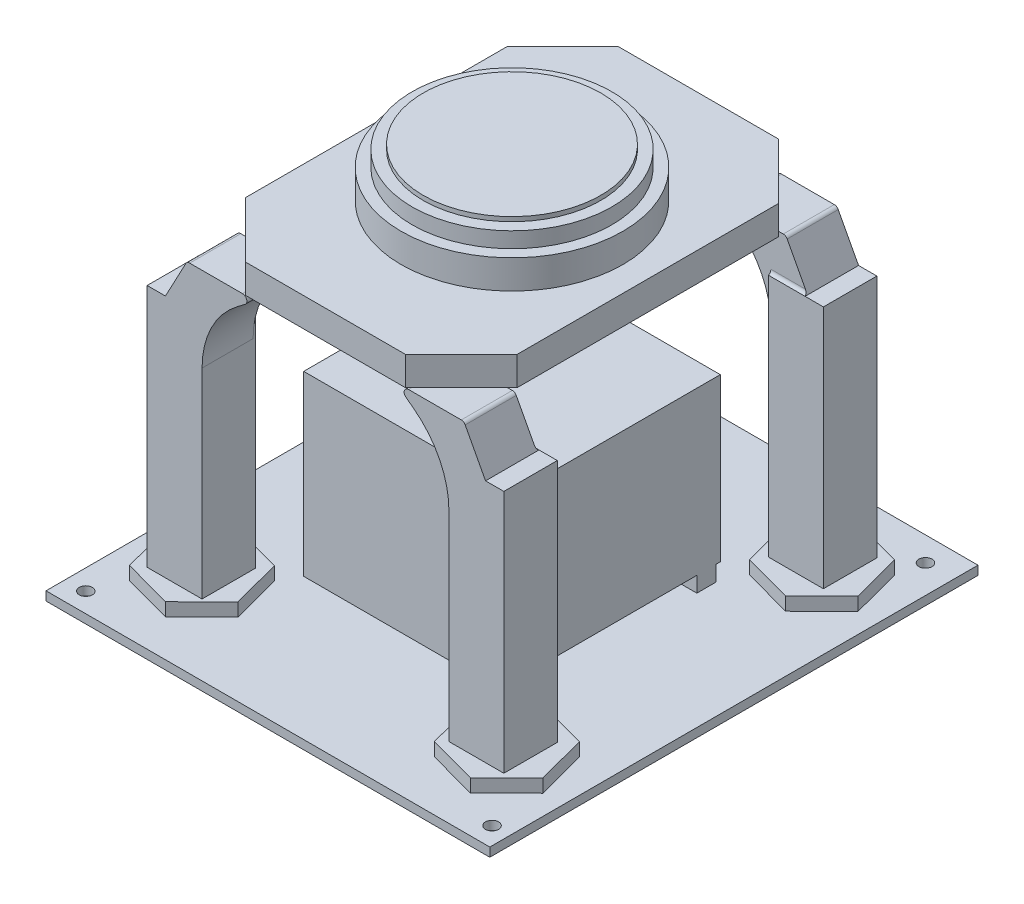
from build123d import *

# Parameters (mm, degrees)
SKETCH2_W            = 1000
SKETCH2_H            = 1100
BOSS_EXTRUDE1_DEPTH  = 20
BOSS_EXTRUDE2_DEPTH  = 30
SKETCH4_W            = 475.735232804
SKETCH4_H            = 462.959293972
BOSS_EXTRUDE3_DEPTH  = 400
SKETCH5_W            = 9.698613805
SKETCH5_H            = 34.812032077
CUT_EXTRUDE1_DEPTH   = 1012.606949035
SKETCH6_W            = 360.413866027
SKETCH6_H            = 34.812032077
CUT_EXTRUDE2_DEPTH   = 1012.606949035
SKETCH7_W            = 115
SKETCH7_H            = 115
BOSS_EXTRUDE4_DEPTH  = 550
BOSS_EXTRUDE6_DEPTH  = 115
FILLET3_R            = 200
FILLET5_R            = 10
FILLET6_R            = 10
FILLET3_OF_MIRROR2_R = 200
MIRROR3_START        = -420.238334409
MIRROR3_DEPTH        = 115
MIRROR3_START_2      = 299.761665591
MIRROR3_2_OUTLINE_W  = 123.720887542
MIRROR3_2_OUTLINE_H  = 550
MIRROR3_2_DEPTH      = 5.476668818
FILLET9_R            = 10
FILLET11_R           = 10
FILLET13_R           = 10
FILLET15_R           = 10
FILLET16_R           = 10
SKETCH9_W            = 611.925919606
SKETCH9_H            = 840.476668818
BOSS_EXTRUDE7_DEPTH  = 65
CUT_EXTRUDE3_DEPTH   = 65
SKETCH13_R           = 250
BOSS_EXTRUDE8_DEPTH  = 65
SKETCH14_R           = 225
BOSS_EXTRUDE9_DEPTH  = 35
SKETCH15_R           = 200
BOSS_EXTRUDE10_DEPTH = 10
SKETCH16_R           = 50
BOSS_EXTRUDE11_DEPTH = 5
SKETCH17_W           = 69.041025083
SKETCH17_H           = 59.313575352
BOSS_EXTRUDE12_DEPTH = 60
CUT_EXTRUDE4_DEPTH   = 90
SKETCH19_R           = 14.770979528
CUT_EXTRUDE5_DEPTH   = 90


# Read off the part's stored shape, not the designer's step: Mirror3
with BuildPart() as part:
    # Sketch2 → Boss-Extrude1 (new body)
    with BuildSketch(Plane(origin=(0, 0, 0), x_dir=(1, 0, 0), z_dir=(0, 1, 0))):
        Rectangle(SKETCH2_W, SKETCH2_H)
    extrude(amount=BOSS_EXTRUDE1_DEPTH)

    # Sketch3 → Boss-Extrude2 (add)
    with BuildSketch(Plane(origin=(0, 20, 0), x_dir=(1, 0, 0), z_dir=(0, 1, 0))):
        Polygon((-232.077673929, 324.898305528), (-261.747565619, 436.491454334), (-373.225013219, 466.593148806), (-455.032569128, 385.101694472), (-425.362677437, 273.508545666), (-313.885229838, 243.406851194), align=None)
        Polygon((-455.032569128, -324.898305528), (-425.362677437, -436.491454334), (-313.885229838, -466.593148806), (-232.077673929, -385.101694472), (-261.747565619, -273.508545666), (-373.225013219, -243.406851194), align=None)
        Polygon((261.747565619, -436.491454334), (373.225013219, -466.593148806), (455.032569128, -385.101694472), (425.362677437, -273.508545666), (313.885229838, -243.406851194), (232.077673929, -324.898305528), align=None)
        Polygon((261.747565619, 273.508545666), (373.225013219, 243.406851194), (455.032569128, 324.898305528), (425.362677437, 436.491454334), (313.885229838, 466.593148806), (232.077673929, 385.101694472), align=None)
    extrude(amount=BOSS_EXTRUDE2_DEPTH)

    # Sketch4 → Boss-Extrude3 (add)
    with BuildSketch(Plane(origin=(0, 20, 0), x_dir=(1, 0, 0), z_dir=(0, 1, 0))):
        Rectangle(SKETCH4_W, SKETCH4_H)
    extrude(amount=BOSS_EXTRUDE3_DEPTH)

    # Sketch5 → Cut-Extrude1 (cut, through all)
    with BuildSketch(Plane.ZY.offset(237.867616402)):
        with Locations((-226.630340084, 37.406016038)):
            Rectangle(SKETCH5_W, SKETCH5_H)
    extrude(amount=-CUT_EXTRUDE1_DEPTH, mode=Mode.SUBTRACT)

    # Sketch6 → Cut-Extrude2 (cut, through all)
    with BuildSketch(Plane.ZY.offset(237.867616402)):
        with Locations((1.590947851, 37.406016038)):
            Rectangle(SKETCH6_W, SKETCH6_H)
    extrude(amount=-CUT_EXTRUDE2_DEPTH, mode=Mode.SUBTRACT)

    # Sketch7 → Boss-Extrude4 (add)
    with BuildSketch(Plane(origin=(0, 50, 0), x_dir=(1, 0, 0), z_dir=(0, 1, 0))):
        with Locations((-335.639556229, 357.261665591)):
            Rectangle(SKETCH7_W, SKETCH7_H)
        with Locations((344.360443771, 357.261665591)):
            Rectangle(SKETCH7_W, SKETCH7_H)
        with Locations((-335.639556229, -362.738334409)):
            Rectangle(SKETCH7_W, SKETCH7_H)
        with Locations((344.360443771, -362.738334409)):
            Rectangle(SKETCH7_W, SKETCH7_H)
    boss_extrude4 = extrude(amount=BOSS_EXTRUDE4_DEPTH)

    # Sketch8 → Boss-Extrude6 (add)
    with BuildSketch(Plane.XY.offset(420.238334409)):
        Polygon((-311.971408496, 691.526051238), (-360.639390354, 600), (-278.139556229, 600), (-157.416765755, 691.526051238), align=None)
    boss_extrude6 = extrude(amount=-BOSS_EXTRUDE6_DEPTH)

    # Fillet3
    fillet3_edges = [part.edges().sort_by_distance(p)[0] for p in [
        (-278.139556229, 600, 362.738334409),
    ]]
    fillet(fillet3_edges, radius=FILLET3_R)

    # Fillet5
    fillet5_edges = [part.edges().sort_by_distance(p)[0] for p in [
        (-157.416765755, 691.526051238, 362.738334409),
    ]]
    fillet(fillet5_edges, radius=FILLET5_R)

    # Fillet6
    fillet6_edges = [part.edges().sort_by_distance(p)[0] for p in [
        (-311.971408496, 691.526051238, 362.738334409),
    ]]
    fillet(fillet6_edges, radius=FILLET6_R)

    # Mirror2: Boss-Extrude4, Boss-Extrude6 across plane
    add(boss_extrude4.mirror(Plane(origin=(0, 0, 0), x_dir=(0, 0, 1), z_dir=(1, 0, 0))))
    add(boss_extrude6.mirror(Plane(origin=(0, 0, 0), x_dir=(0, 0, 1), z_dir=(1, 0, 0))))

    # Fillet3 of Mirror2
    fillet3_of_mirror2_edges = [part.edges().sort_by_distance(p)[0] for p in [
        (278.139556229, 600, 362.738334409),
    ]]
    fillet(fillet3_of_mirror2_edges, radius=FILLET3_OF_MIRROR2_R)

    # Mirror3 outline → Mirror3 (add)
    with BuildSketch(Plane.XY.offset(MIRROR3_START)):
        with BuildLine():
            Line((-278.139556229, 50), (-278.139556229, 500.648656801))
            ThreePointArc((-278.139556229, 500.648656801), (-257.256761918, 589.626331677), (-198.969289966, 660.022981726))
            Line((-198.969289966, 660.022981726), (-157.416765755, 691.526051238))
            Line((-157.416765755, 691.526051238), (-311.971408496, 691.526051238))
            Line((-311.971408496, 691.526051238), (-360.639390354, 600))
            Line((-360.639390354, 600), (-401.860443771, 600))
            Line((-401.860443771, 600), (-401.860443771, 50))
            Line((-401.860443771, 50), (-278.139556229, 50))
        make_face()
        with BuildLine():
            Line((401.860443771, 50), (401.860443771, 600))
            Line((401.860443771, 600), (360.639390354, 600))
            Line((360.639390354, 600), (311.971408496, 691.526051238))
            Line((311.971408496, 691.526051238), (157.416765755, 691.526051238))
            Line((157.416765755, 691.526051238), (198.969289966, 660.022981726))
            ThreePointArc((198.969289966, 660.022981726), (257.256761918, 589.626331677), (278.139556229, 500.648656801))
            Line((278.139556229, 500.648656801), (278.139556229, 50))
            Line((278.139556229, 50), (401.860443771, 50))
        make_face()
    extrude(amount=MIRROR3_DEPTH)

    # Mirror3 2 outline → Mirror3 2 (add)
    with BuildSketch(Plane.XY.offset(MIRROR3_START_2)):
        with Locations((-340, 325)):
            Rectangle(MIRROR3_2_OUTLINE_W, MIRROR3_2_OUTLINE_H)
        with Locations((340, 325)):
            Rectangle(MIRROR3_2_OUTLINE_W, MIRROR3_2_OUTLINE_H)
    extrude(amount=MIRROR3_2_DEPTH)

    # Fillet9
    # the kernel refuses this fillet: 10 mm, written as the material it adds along each edge
    with BuildSketch(Plane(origin=(-278.139556229, 600, -305.238334409), x_dir=(0, 0, 1), z_dir=(-1, 0, 0))) as fillet9_piece_1_section:
        with BuildLine():
            CenterArc((10, 8.918490625), FILLET9_R, 180, 63.10652679)
            Line((0, 8.918490625), (-0.2, 8.918490625))
            Line((-0.2, 8.918490625), (-0.2, 0))
            Line((-0.2, 0), (0, -0.2))
            ThreePointArc((0, -0.2), (2.738334409, -0.2), (5.386202195, -0.178369812))
            Line((5.386202195, -0.178369812), (5.476668818, 0))
        make_face()
    fillet9_piece_1 = extrude(amount=104.796060686, mode=Mode.PRIVATE)
    fillet9_piece_1 = split(fillet9_piece_1, bisect_by=Plane(origin=(-350.518364197, 619.033819017, -303.80875695), z_dir=(0.882936727210202, -0.46949199752853876, 0)), keep=Keep.TOP, mode=Mode.PRIVATE)
    add(fillet9_piece_1)

    # Fillet11
    # the kernel refuses this fillet: 10 mm, written as the material it adds along each edge
    with BuildSketch(Plane(origin=(-278.139556229, 600, 305.238334409), x_dir=(0, 0, -1), z_dir=(-1, 0, 0))) as fillet11_piece_1_section:
        with BuildLine():
            CenterArc((10, -8.918490625), FILLET11_R, 116.89347321, 63.10652679)
            Line((0, -8.918490625), (-0.2, -8.918490625))
            Line((-0.2, -8.918490625), (-0.2, 0))
            Line((-0.2, 0), (0, 0.2))
            ThreePointArc((0, 0.2), (2.738334409, 0.2), (5.386202194, 0.178369812))
            Line((5.386202194, 0.178369812), (5.476668818, 0))
        make_face()
    fillet11_piece_1 = extrude(amount=104.796060686, mode=Mode.PRIVATE)
    fillet11_piece_1 = split(fillet11_piece_1, bisect_by=Plane(origin=(-350.518364197, 619.033819017, 303.80875695), z_dir=(0.8829367272129939, -0.4694919975232882, 0)), keep=Keep.TOP, mode=Mode.PRIVATE)
    add(fillet11_piece_1)

    # Fillet13
    # the kernel refuses this fillet: 10 mm, written as the material it adds along each edge
    with BuildSketch(Plane(origin=(278.139556229, 600, -305.238334409), x_dir=(0, 1, 0), z_dir=(1, 0, 0))) as fillet13_piece_1_section:
        with BuildLine():
            CenterArc((8.918490625, 10), FILLET13_R, 206.89347321, 63.10652679)
            Line((0, 5.476668818), (-0.178369812, 5.386202195))
            ThreePointArc((-0.178369812, 5.386202195), (-0.2, 2.738334409), (-0.2, 0))
            Line((-0.2, 0), (0, -0.2))
            Line((0, -0.2), (8.918490625, -0.2))
            Line((8.918490625, -0.2), (8.918490625, 0))
        make_face()
    fillet13_piece_1 = extrude(amount=104.796060686, mode=Mode.PRIVATE)
    fillet13_piece_1 = split(fillet13_piece_1, bisect_by=Plane(origin=(350.518364197, 619.033819017, -303.80875695), z_dir=(-0.882936727210202, -0.46949199752853876, 0)), keep=Keep.TOP, mode=Mode.PRIVATE)
    add(fillet13_piece_1)

    # Fillet15
    # the kernel refuses this fillet: 10 mm, written as the material it adds along each edge
    with BuildSketch(Plane(origin=(382.935616915, 600, 305.238334409), x_dir=(0, 0, -1), z_dir=(-1, 0, 0))) as fillet15_piece_1_section:
        with BuildLine():
            CenterArc((10, -8.918490625), FILLET15_R, 116.89347321, 63.10652679)
            Line((0, -8.918490625), (-0.2, -8.918490625))
            Line((-0.2, -8.918490625), (-0.2, 0))
            Line((-0.2, 0), (0, 0.2))
            ThreePointArc((0, 0.2), (2.738334409, 0.2), (5.386202195, 0.178369812))
            Line((5.386202195, 0.178369812), (5.476668818, 0))
        make_face()
    fillet15_piece_1 = extrude(amount=104.796060686, mode=Mode.PRIVATE)
    fillet15_piece_1 = split(fillet15_piece_1, bisect_by=Plane(origin=(350.518364197, 619.033819017, 303.80875695), z_dir=(-0.8829367272129939, -0.4694919975232882, 0)), keep=Keep.TOP, mode=Mode.PRIVATE)
    add(fillet15_piece_1)

    # Fillet16
    fillet16_edges = [part.edges().sort_by_distance(p)[0] for p in [
        (157.416765755, 691.526051238, 362.738334409),
        (311.971408496, 691.526051238, 362.738334409),
        (157.416765755, 691.526051238, -362.738334409),
        (311.971408496, 691.526051238, -362.738334409),
        (-157.416765755, 691.526051238, -362.738334409),
        (-311.971408496, 691.526051238, -362.738334409),
    ]]
    fillet(fillet16_edges, radius=FILLET16_R)

    # Sketch9 → Boss-Extrude7 (add)
    with BuildSketch(Plane(origin=(0, 691.526051238, 0), x_dir=(1, 0, 0), z_dir=(0, 1, 0))):
        Rectangle(SKETCH9_W, SKETCH9_H)
    extrude(amount=BOSS_EXTRUDE7_DEPTH)

    # Sketch12 → Cut-Extrude3 (cut)
    with BuildSketch(Plane(origin=(0, 756.526051238, 0), x_dir=(1, 0, 0), z_dir=(0, 1, 0))):
        Polygon((-305.962959803, -420.238334409), (-305.962959803, -294.318020805), (-180.042646199, -420.238334409), align=None)
        Polygon((180.042646199, 420.238334409), (305.962959803, 420.238334409), (305.962959803, 294.318020805), align=None)
        Polygon((-305.962959803, 294.318020805), (-180.042646199, 420.238334409), (-305.962959803, 420.238334409), align=None)
        Polygon((305.962959803, -294.318020805), (180.042646199, -420.238334409), (305.962959803, -420.238334409), align=None)
    extrude(amount=-CUT_EXTRUDE3_DEPTH, mode=Mode.SUBTRACT)

    # Sketch13 → Boss-Extrude8 (add)
    with BuildSketch(Plane(origin=(0, 756.526051238, 0), x_dir=(1, 0, 0), z_dir=(0, 1, 0))):
        with Locations(Location((0, 0, 0), (0, 0, 270))):
            Circle(SKETCH13_R)
    extrude(amount=BOSS_EXTRUDE8_DEPTH)

    # Sketch14 → Boss-Extrude9 (add)
    with BuildSketch(Plane(origin=(0, 821.526051238, 0), x_dir=(1, 0, 0), z_dir=(0, 1, 0))):
        with Locations(Location((0, 0, 0), (0, 0, 270))):
            Circle(SKETCH14_R)
    extrude(amount=BOSS_EXTRUDE9_DEPTH)

    # Sketch15 → Boss-Extrude10 (add)
    with BuildSketch(Plane(origin=(0, 856.526051238, 0), x_dir=(1, 0, 0), z_dir=(0, 1, 0))):
        with Locations(Location((0, 0, 0), (0, 0, 270))):
            Circle(SKETCH15_R)
    extrude(amount=BOSS_EXTRUDE10_DEPTH)

    # Sketch16 → Boss-Extrude11 (add)
    with BuildSketch(Plane.XZ.offset(-691.526051238)):
        with Locations(Location((-149.292458402, 0, 0), (0, 0, 270))):
            Circle(SKETCH16_R)
    extrude(amount=BOSS_EXTRUDE11_DEPTH)

    # Sketch17 → Boss-Extrude12 (add)
    with BuildSketch(Plane(origin=(0, 0, -231.479646986), x_dir=(-1, 0, 0), z_dir=(0, 0, -1))):
        with Locations((-67.163178289, 219.321580657)):
            Rectangle(SKETCH17_W, SKETCH17_H)
    extrude(amount=BOSS_EXTRUDE12_DEPTH)

    # Sketch18 → Cut-Extrude4 (cut)
    with BuildSketch(Plane(origin=(101.683690831, 0, 0), x_dir=(0, 0, -1), z_dir=(1, 0, 0))):
        Polygon((291.479646986, 248.978368333), (272.137715086, 189.664792981), (291.479646986, 189.664792981), align=None)
    extrude(amount=-CUT_EXTRUDE4_DEPTH, mode=Mode.SUBTRACT)

    # Sketch19 → Cut-Extrude5 (cut)
    with BuildSketch(Plane(origin=(0, 20, 0), x_dir=(1, 0, 0), z_dir=(0, 1, 0))):
        with Locations(Location((436.332182741, 495.334248605, 0), (0, 0, 270))):
            Circle(SKETCH19_R)
        with Locations(Location((-454.586016885, 496.237081752, 0), (0, 0, 270))):
            Circle(SKETCH19_R)
        with Locations(Location((-454.586016885, -505.767019401, 0), (0, 0, 270))):
            Circle(SKETCH19_R)
        with Locations(Location((460.758535381, -505.767019401, 0), (0, 0, 270))):
            Circle(SKETCH19_R)
    extrude(amount=-CUT_EXTRUDE5_DEPTH, mode=Mode.SUBTRACT)


solid = part.part
